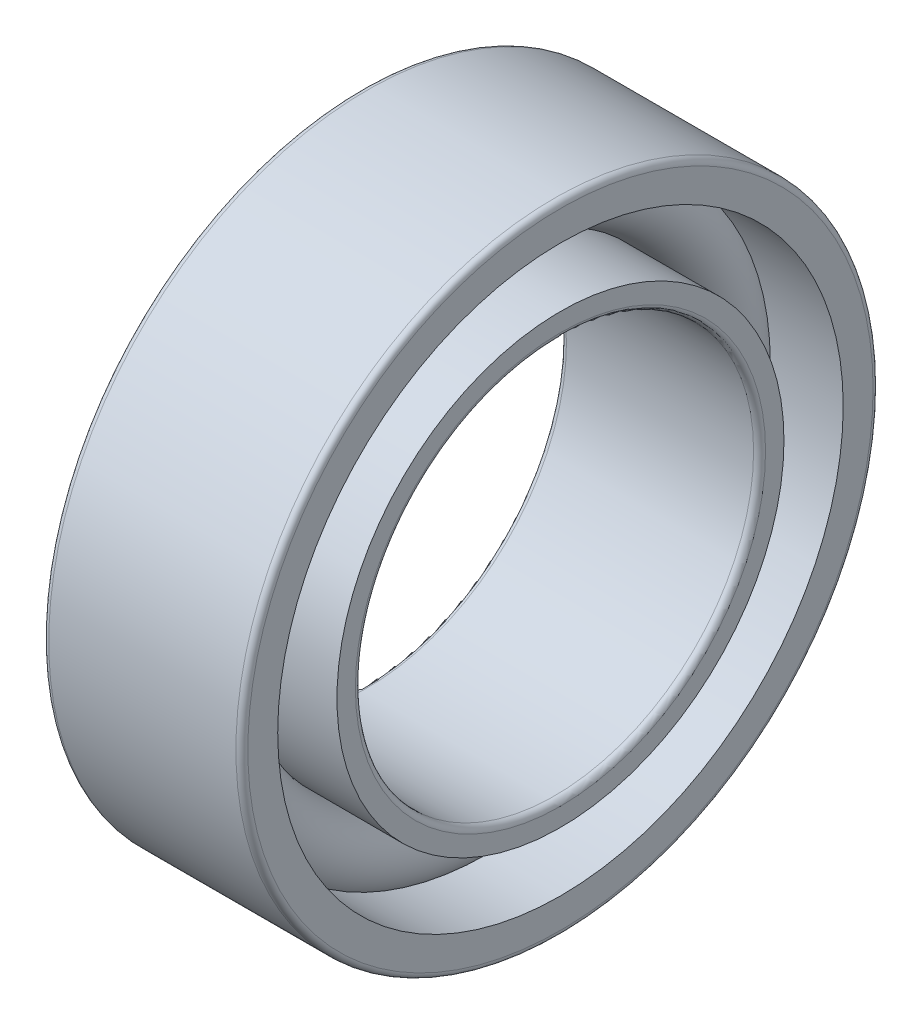
from build123d import *

# Parameters (mm, degrees)
CAGSPISKE_W     = 0.9
CAGSPISKE_H     = 0.6
CAGESPINE_ANGLE = 0.001
BALSIMSKE_R     = 1.8


with BuildPart() as part:
    # CagSpiSke → CageSpine (revolve)
    with BuildSketch(Plane.XY):
        with Locations((0, 13)):
            Rectangle(CAGSPISKE_W, CAGSPISKE_H)
    revolve(axis=Axis((-20.6375, 0, 0), (1, 0, 0)), revolution_arc=CAGESPINE_ANGLE)

    # BalSimSke → BallsSimplified (revolve)
    with BuildSketch(Plane.XY):
        with Locations((0, 13)):
            Circle(BALSIMSKE_R)
    revolve(axis=Axis((-10, 0, 0), (1, 0, 0)))

    # InnRacSke → InnerRace (revolve)
    with BuildSketch(Plane.XY):
        with BuildLine():
            Line((-1.307908636, 11.8), (-5, 11.8))
            Line((-5, 11.8), (-5, 10.3))
            ThreePointArc((-5, 10.3), (-4.912132034, 10.087867966), (-4.7, 10))
            Line((-4.7, 10), (4.7, 10))
            ThreePointArc((4.7, 10), (4.912132034, 10.087867966), (5, 10.3))
            Line((5, 10.3), (5, 11.225))
            Line((5, 11.225), (0, 11.225))
            ThreePointArc((0, 11.225), (-0.714361603, 11.375096157), (-1.307908636, 11.8))
        make_face()
    revolve(axis=Axis((-20.6375, 0, 0), (1, 0, 0)))

    # OutRacSke → OuterRace (revolve)
    with BuildSketch(Plane.XY):
        with BuildLine():
            Line((0, 14.775), (-5, 14.775))
            Line((-5, 14.775), (-5, 15.7))
            ThreePointArc((-5, 15.7), (-4.912132034, 15.912132034), (-4.7, 16))
            Line((-4.7, 16), (4.7, 16))
            ThreePointArc((4.7, 16), (4.912132034, 15.912132034), (5, 15.7))
            Line((5, 15.7), (5, 14.2))
            Line((5, 14.2), (1.307908636, 14.2))
            ThreePointArc((1.307908636, 14.2), (0.714361603, 14.624903843), (0, 14.775))
        make_face()
    revolve(axis=Axis((-20.6375, 0, 0), (1, 0, 0)))


solid = part.part
